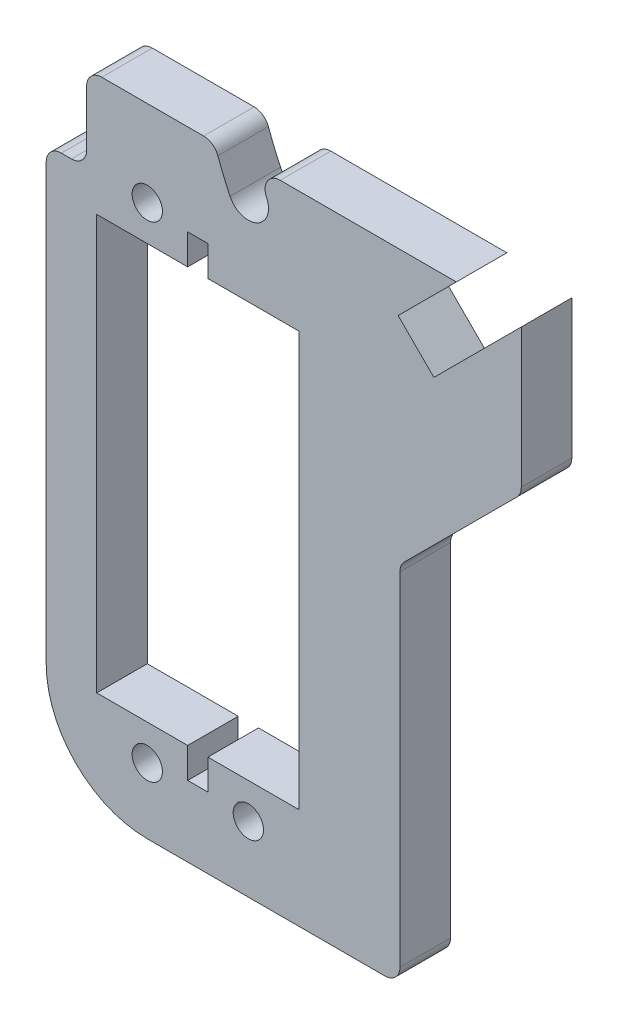
from build123d import *

# Parameters (mm, degrees)
ESQUISSE1_R        = 1.5
BOSS_EXTRU_1_DEPTH = 5
CONG_2_R           = 10
CONG_3_R           = 1.5


with BuildPart() as part:
    # Esquisse1 → Boss.-Extru.1 (new body)
    with BuildSketch(Plane.XY):
        with BuildLine():
            Line((0, 54.5), (0, 0))
            Line((0, 0), (35, 0))
            Line((35, 0), (35, 36))
            Line((35, 36), (47, 48))
            Line((47, 48), (47, 62.352588562))
            Line((47, 62.352588562), (38.354928639, 53.707517201))
            Line((38.354928639, 53.707517201), (34.819394733, 57.243051107))
            Line((34.819394733, 57.243051107), (40.576343626, 63))
            Line((40.576343626, 63), (20.884445569, 63))
            ThreePointArc((20.884445569, 63), (21.318813491, 61.92160006), (21.797998705, 60.862353415))
            ThreePointArc((21.797998705, 60.862353415), (20.855817114, 58.195464994), (18.188928693, 59.137646585))
            ThreePointArc((18.188928693, 59.137646585), (17.353768977, 61.043504289), (16.645313, 63))
            Line((16.645313, 63), (4, 63))
            Line((4, 63), (4, 54.5))
            Line((4, 54.5), (0, 54.5))
        make_face()
        with Locations((10, 6.5)):
            Circle(ESQUISSE1_R, mode=Mode.SUBTRACT)
        with Locations((20, 6.5)):
            Circle(ESQUISSE1_R, mode=Mode.SUBTRACT)
        Polygon((5, 51), (14, 51), (14, 54), (16, 54), (16, 51), (25, 51), (25, 10), (16, 10), (16, 7), (14, 7), (14, 10), (5, 10), align=None, mode=Mode.SUBTRACT)
        with Locations((10, 54.5)):
            Circle(ESQUISSE1_R, mode=Mode.SUBTRACT)
    extrude(amount=BOSS_EXTRU_1_DEPTH)

    # Congé2
    cong_2_edges = [part.edges().sort_by_distance(p)[0] for p in [
        (0, 0, 2.5),
    ]]
    fillet(cong_2_edges, radius=CONG_2_R)

    # Congé3
    cong_3_edges = [part.edges().sort_by_distance(p)[0] for p in [
        (4, 54.5, 2.5),
        (0, 54.5, 2.5),
        (4, 63, 2.5),
        (20.884445569, 63, 2.5),
        (16.645313, 63, 2.5),
        (47, 48, 2.5),
        (35, 0, 2.5),
        (35, 36, 2.5),
    ]]
    fillet(cong_3_edges, radius=CONG_3_R)


solid = part.part
